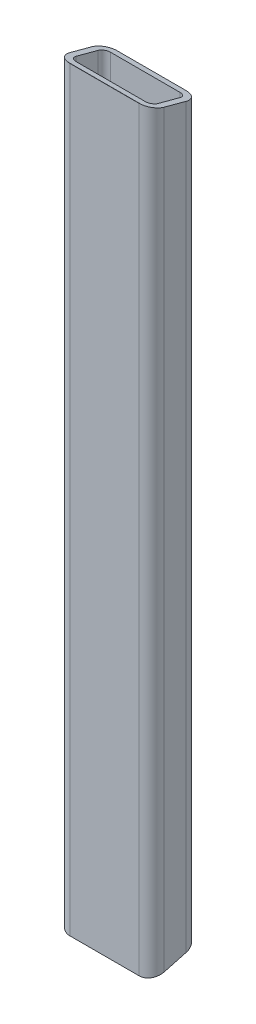
from build123d import *

# Parameters (mm, degrees)
EXTRUDE_1_DEPTH      = 120
EXTRUDE_1_DEPTH_BACK = 120
CHAMFER_1_SIZE       = 4
CHAMFER_1_SIZE_2     = 14.92820323


with BuildPart() as part:
    # Эскиз1 → Вытянуть-Тонкостенный1 (new, two sides: drawn at the far end of the back side and taken through both)
    with BuildSketch(Plane(origin=(0, 0, 0), x_dir=(1, 0, 0), z_dir=(0, 1, 0)).offset(-EXTRUDE_1_DEPTH_BACK)):
        with BuildLine():
            Line((-11, 7.5), (11, 7.5))
            ThreePointArc((11, 7.5), (13.828427125, 6.328427125), (15, 3.5))
            Line((15, 3.5), (15, -3.5))
            ThreePointArc((15, -3.5), (13.828427125, -6.328427125), (11, -7.5))
            Line((11, -7.5), (-11, -7.5))
            ThreePointArc((-11, -7.5), (-13.828427125, -6.328427125), (-15, -3.5))
            Line((-15, -3.5), (-15, 3.5))
            ThreePointArc((-15, 3.5), (-13.828427125, 6.328427125), (-11, 7.5))
        make_face()
        with BuildLine():
            Line((-11, 5.5), (11, 5.5))
            ThreePointArc((11, 5.5), (12.414213562, 4.914213562), (13, 3.5))
            Line((13, 3.5), (13, -3.5))
            ThreePointArc((13, -3.5), (12.414213562, -4.914213562), (11, -5.5))
            Line((11, -5.5), (-11, -5.5))
            ThreePointArc((-11, -5.5), (-12.414213562, -4.914213562), (-13, -3.5))
            Line((-13, -3.5), (-13, 3.5))
            ThreePointArc((-13, 3.5), (-12.414213562, 4.914213562), (-11, 5.5))
        make_face(mode=Mode.SUBTRACT)
    extrude(amount=EXTRUDE_1_DEPTH + EXTRUDE_1_DEPTH_BACK)

    # Фаска1
    # the kernel refuses this chamfer: 14.92820323, 4 mm, written as the material it takes off along each edge
    with BuildSketch(Plane(origin=(-49.764387332, 120, -7.5), x_dir=(0, -0.990500038825954, -0.1375124470212912), z_dir=(1, 0, 0))) as chamfer_1_piece_1:
        Polygon((CHAMFER_1_SIZE * 0.990500038826, -CHAMFER_1_SIZE * 0.137512447021), (-CHAMFER_1_SIZE_2 * 0.137512447024, -CHAMFER_1_SIZE_2 * 0.990500038844), (0, 0), align=None)
    extrude(amount=99.528774665, mode=Mode.SUBTRACT)
    with BuildSketch(Plane(origin=(-49.764387332, -120, -7.5), x_dir=(0, -0.009967146577155871, 0.9999503267608394), z_dir=(1, 0, 0))) as chamfer_1_piece_2:
        Polygon((CHAMFER_1_SIZE_2 * 0.999950326779, -CHAMFER_1_SIZE_2 * 0.00996714657734), (-CHAMFER_1_SIZE * 0.00996714657716, -CHAMFER_1_SIZE * 0.999950326761), (0, 0), align=None)
    extrude(amount=99.528774665, mode=Mode.SUBTRACT)


solid = part.part
